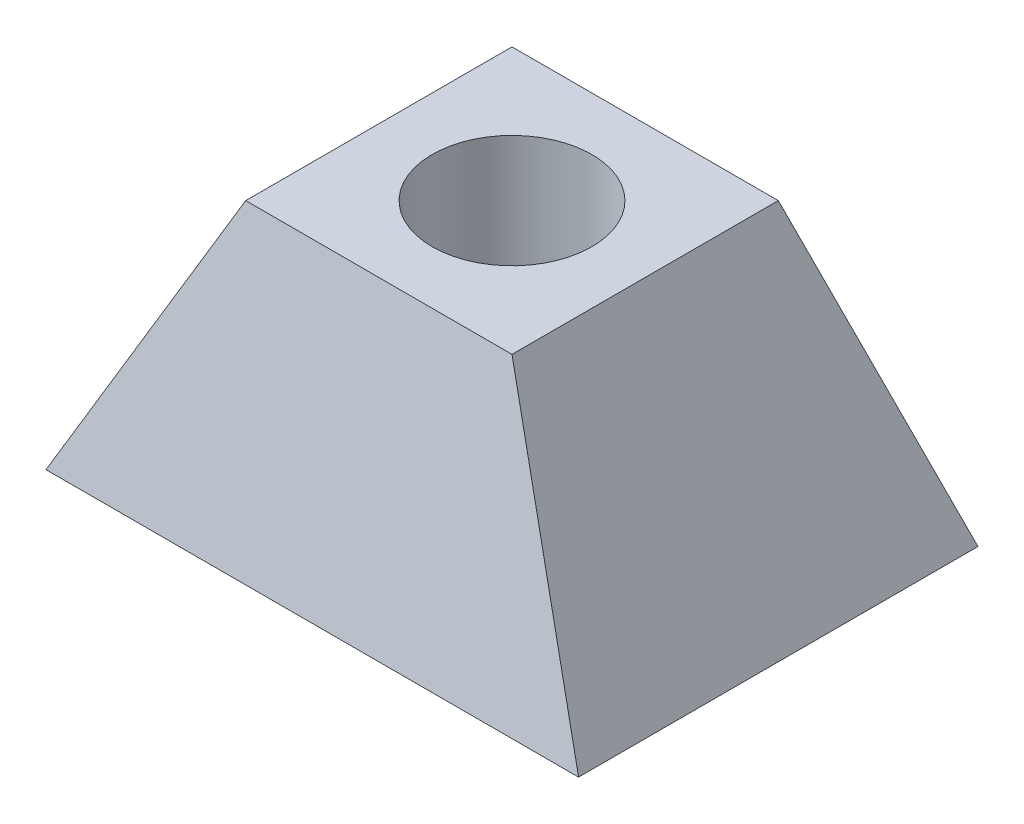
from build123d import *

# Parameters (mm, degrees)
HOLE_FOR_HOOK_START     = -12.7
HOLE_FOR_HOOK_OUTLINE_R = 3.81
HOLE_FOR_HOOK_DEPTH     = 12.7


# Read off the part's stored shape, not the designer's step: Hole-For-Hook
with BuildPart() as part:
    # Sketch-Rectangle → Loft1 section 0
    with BuildSketch(Plane(origin=(0, 0, 0), x_dir=(1, 0, 0), z_dir=(0, 1, 0))):
        with BuildLine():
            Line((-12.7, -9.525), (12.7, -9.525))
            Line((12.7, -9.525), (12.7, 9.525))
            Line((12.7, 9.525), (-12.7, 9.525))
            Line((-12.7, 9.525), (-12.7, -9.525))
        make_face()
    # Sketch-Square → Loft1 section 1
    with BuildSketch(Plane(origin=(0, 12.7, 0), x_dir=(1, 0, 0), z_dir=(0, 1, 0))):
        with BuildLine():
            Line((-6.35, -6.35), (6.35, -6.35))
            Line((6.35, -6.35), (6.35, 6.35))
            Line((6.35, 6.35), (-6.35, 6.35))
            Line((-6.35, 6.35), (-6.35, -6.35))
        make_face()
    loft()

    # Hole-For-Hook outline → Hole-For-Hook (cut)
    with BuildSketch(Plane(origin=(0, 12.7, 0), x_dir=(1, 0, 0), z_dir=(0, 1, 0)).offset(HOLE_FOR_HOOK_START)):
        Circle(HOLE_FOR_HOOK_OUTLINE_R)
    extrude(amount=HOLE_FOR_HOOK_DEPTH, mode=Mode.SUBTRACT)


solid = part.part
